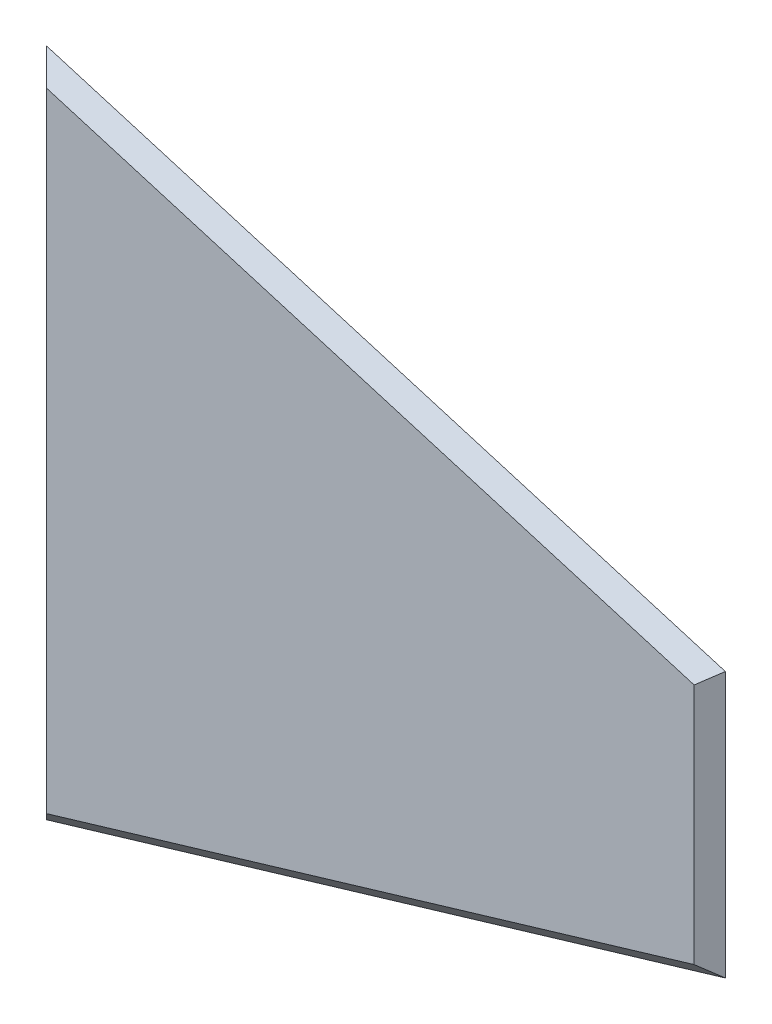
from build123d import *

# Parameters (mm, degrees)
AUFSATZ_LINEAR_AUSTRAGEN1_DEPTH = 10
FASE1_SIZE                      = 10


with BuildPart() as part:
    # Skizze1 → Aufsatz-Linear austragen1 (new body)
    with BuildSketch(Plane.XY):
        Polygon((-434.714346895, -214.6), (-434.714346895, 214.6), (0, 85), (0, -85), align=None)
    extrude(amount=AUFSATZ_LINEAR_AUSTRAGEN1_DEPTH)

    # Fase1
    fase1_edges = [part.edges().sort_by_distance(p)[0] for p in [
        (-434.714346895, 0, 10),
        (-217.357173448, 149.8, 10),
        (0, 0, 10),
        (-217.357173448, -149.8, 10),
    ]]
    chamfer(fase1_edges, length=FASE1_SIZE - 0.0001)  # a hair under: the kernel refuses the full size


solid = part.part
